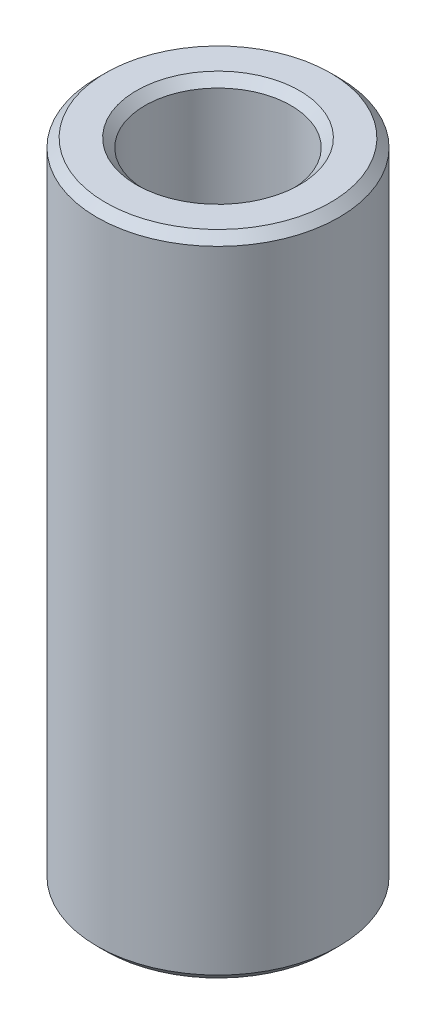
from build123d import *

# Parameters (mm, degrees)
SKETCH1_R           = 40
BOSS_EXTRUDE1_DEPTH = 214.372509117
SKETCH2_R           = 24.14900345
CUT_EXTRUDE1_DEPTH  = 222.710560563
CHAMFER1_SIZE       = 2.837008593


with BuildPart() as part:
    # Sketch1 → Boss-Extrude1 (new body)
    with BuildSketch(Plane(origin=(0, 0, 0), x_dir=(1, 0, 0), z_dir=(0, 1, 0))):
        Circle(SKETCH1_R)
    extrude(amount=BOSS_EXTRUDE1_DEPTH)

    # Sketch2 → Cut-Extrude1 (cut, through all)
    with BuildSketch(Plane(origin=(0, 0, 0), x_dir=(1, 0, 0), z_dir=(0, 1, 0))):
        Circle(SKETCH2_R)
    extrude(amount=CUT_EXTRUDE1_DEPTH, mode=Mode.SUBTRACT)

    # Chamfer1
    chamfer1_edges = [part.edges().sort_by_distance(p)[0] for p in [
        (-24.14900345, 214.372509117, 0),
        (-24.14900345, 0, 0),
        (-40, 0, 0),
        (-40, 214.372509117, 0),
    ]]
    chamfer(chamfer1_edges, length=CHAMFER1_SIZE)


solid = part.part
